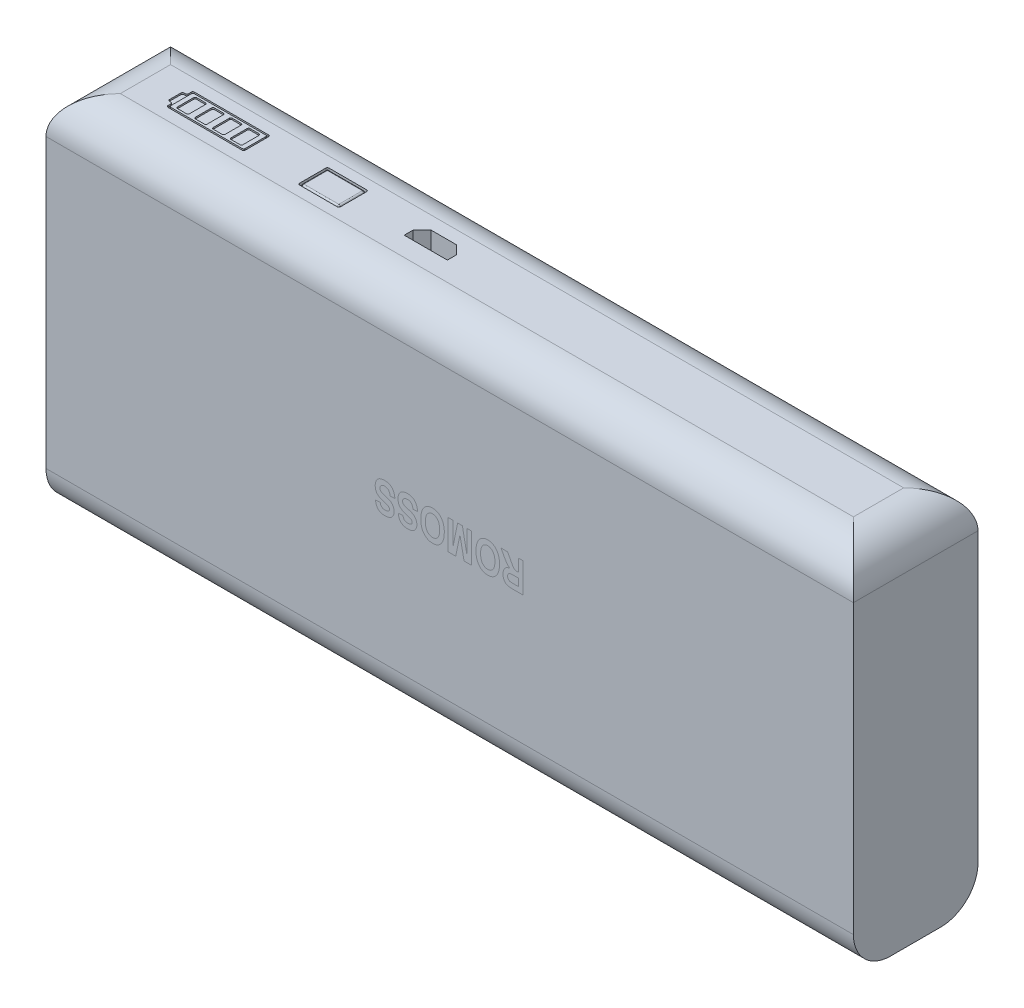
from build123d import *
from OCP.BRepFilletAPI import BRepFilletAPI_MakeChamfer

# Parameters (mm, degrees)
SKETCH1_W               = 137.9728
SKETCH1_H               = 21.2852
BOSS_EXTRUDE1_DEPTH     = 61.8236
FILLET10_R              = 6.35
FILLET11_R              = 6.35
SKETCH5_W               = 12.7
SKETCH5_H               = 4.0132
CUT_EXTRUDE1_DEPTH      = 0.254
FILLET12_R              = 0.254
SKETCH6_W               = 2.032
SKETCH6_H               = 3.2512
CUT_EXTRUDE2_DEPTH      = 0.254
FILLET13_R              = 0.254
LPATTERN1_COUNT         = 4
LPATTERN1_PITCH         = 3.048
FILLET13_OF_LPATTERN1_R = 0.254
SKETCH7_W               = 6.985
SKETCH7_H               = 5.0292
CUT_EXTRUDE3_DEPTH      = 0.508
SKETCH8_W               = 6.477
SKETCH8_H               = 4.5212
BOSS_EXTRUDE2_DEPTH     = 0.508
FILLET15_R              = 0.254
FILLET16_R              = 0.254
CUT_EXTRUDE4_DEPTH      = 6.35
SKETCH10_W              = 5.08
SKETCH10_H              = 12.7
CUT_EXTRUDE5_DEPTH      = 15.24
SKETCH11_W              = 1.27
SKETCH11_H              = 11.43
BOSS_EXTRUDE3_DEPTH     = 11.43
CHAMFER2_SIZE           = 0.508
CHAMFER2_SIZE2          = 0.293293937
SKETCH12_R              = 1.27
CUT_EXTRUDE6_DEPTH      = 0.254


with BuildPart() as part:
    # Sketch1 → Boss-Extrude1 (new body)
    with BuildSketch(Plane(origin=(0, 0, 0), x_dir=(1, 0, 0), z_dir=(0, 1, 0))):
        Rectangle(SKETCH1_W, SKETCH1_H)
    extrude(amount=BOSS_EXTRUDE1_DEPTH)

    # Fillet10
    fillet10_edges = [part.edges().sort_by_distance(p)[0] for p in [
        (-68.9864, 61.8236, 0),
        (0, 61.8236, 10.6426),
        (0, 61.8236, -10.6426),
        (68.9864, 61.8236, 0),
    ]]
    fillet(fillet10_edges, radius=FILLET10_R)

    # Fillet11
    fillet11_edges = [part.edges().sort_by_distance(p)[0] for p in [
        (0, 0, 10.6426),
        (0, 0, -10.6426),
    ]]
    fillet(fillet11_edges, radius=FILLET11_R)

    # Sketch5 → Cut-Extrude1 (cut)
    with BuildSketch(Plane(origin=(0, 61.8236, 0), x_dir=(1, 0, 0), z_dir=(0, 1, 0))):
        Polygon((-56.7944, 2.2606), (-56.7944, 1.2446), (-57.5564, 1.2446), (-57.5564, -1.2446), (-56.7944, -1.2446), (-56.7944, -2.2606), (-43.5864, -2.2606), (-43.5864, 2.2606), align=None)
        with Locations((-50.1904, 0)):
            Rectangle(SKETCH5_W, SKETCH5_H, mode=Mode.SUBTRACT)
    extrude(amount=-CUT_EXTRUDE1_DEPTH, mode=Mode.SUBTRACT)

    # Fillet12
    fillet12_edges = [part.edges().sort_by_distance(p)[0] for p in [
        (-43.5864, 61.6966, -2.2606),
        (-43.5864, 61.6966, 2.2606),
        (-43.8404, 61.6966, -2.0066),
        (-43.8404, 61.6966, 2.0066),
        (-56.5404, 61.6966, -2.0066),
        (-56.5404, 61.6966, 2.0066),
        (-56.7944, 61.6966, 2.2606),
        (-56.7944, 61.6966, 1.2446),
        (-56.7944, 61.6966, -1.2446),
        (-56.7944, 61.6966, -2.2606),
        (-57.5564, 61.6966, -1.2446),
        (-57.5564, 61.6966, 1.2446),
    ]]
    fillet(fillet12_edges, radius=FILLET12_R)

    # Sketch6 → Cut-Extrude2 (cut)
    with BuildSketch(Plane(origin=(0, 61.8236, 0), x_dir=(1, 0, 0), z_dir=(0, 1, 0))):
        with Locations((-54.7624, 0)):
            Rectangle(SKETCH6_W, SKETCH6_H)
    cut_extrude2 = extrude(amount=-CUT_EXTRUDE2_DEPTH, mode=Mode.SUBTRACT)

    # Fillet13
    fillet13_edges = [part.edges().sort_by_distance(p)[0] for p in [
        (-53.7464, 61.6966, 1.6256),
        (-55.7784, 61.6966, 1.6256),
        (-53.7464, 61.6966, -1.6256),
        (-55.7784, 61.6966, -1.6256),
    ]]
    fillet(fillet13_edges, radius=FILLET13_R)

    # LPattern1: Cut-Extrude2 ×4
    with Locations(*[(i * LPATTERN1_PITCH, 0, 0) for i in range(1, LPATTERN1_COUNT)]):
        add(cut_extrude2, mode=Mode.SUBTRACT)

    # Fillet13 of LPattern1
    fillet13_of_lpattern1_edges = [part.edges().sort_by_distance(p)[0] for p in [
        (-50.6984, 61.6966, 1.6256),
        (-52.7304, 61.6966, 1.6256),
        (-50.6984, 61.6966, -1.6256),
        (-52.7304, 61.6966, -1.6256),
        (-47.6504, 61.6966, 1.6256),
        (-49.6824, 61.6966, 1.6256),
        (-47.6504, 61.6966, -1.6256),
        (-49.6824, 61.6966, -1.6256),
        (-44.6024, 61.6966, 1.6256),
        (-46.6344, 61.6966, 1.6256),
        (-44.6024, 61.6966, -1.6256),
        (-46.6344, 61.6966, -1.6256),
    ]]
    fillet(fillet13_of_lpattern1_edges, radius=FILLET13_OF_LPATTERN1_R)

    # Sketch7 → Cut-Extrude3 (cut)
    with BuildSketch(Plane(origin=(0, 61.8236, 0), x_dir=(1, 0, 0), z_dir=(0, 1, 0))):
        with Locations((-30.5689, 0)):
            Rectangle(SKETCH7_W, SKETCH7_H)
    extrude(amount=-CUT_EXTRUDE3_DEPTH, mode=Mode.SUBTRACT)

    # Sketch8 → Boss-Extrude2 (add)
    with BuildSketch(Plane(origin=(0, 61.3156, 0), x_dir=(1, 0, 0), z_dir=(0, 1, 0))):
        with Locations((-30.5689, 0)):
            Rectangle(SKETCH8_W, SKETCH8_H)
    extrude(amount=BOSS_EXTRUDE2_DEPTH)

    # Fillet15
    fillet15_edges = [part.edges().sort_by_distance(p)[0] for p in [
        (-27.0764, 61.5696, 2.5146),
        (-27.0764, 61.5696, -2.5146),
        (-34.0614, 61.5696, -2.5146),
        (-34.0614, 61.5696, 2.5146),
    ]]
    fillet(fillet15_edges, radius=FILLET15_R)

    # Fillet16
    fillet16_edges = [part.edges().sort_by_distance(p)[0] for p in [
        (-30.5689, 61.8236, -2.2606),
        (-27.3304, 61.8236, 0),
        (-30.5689, 61.8236, 2.2606),
        (-33.8074, 61.8236, 0),
        (-33.8074, 61.5696, -2.2606),
        (-27.3304, 61.5696, -2.2606),
        (-27.3304, 61.5696, 2.2606),
        (-33.8074, 61.5696, 2.2606),
    ]]
    fillet(fillet16_edges, radius=FILLET16_R)

    # Sketch9 → Cut-Extrude4 (cut)
    with BuildSketch(Plane(origin=(0, 61.8236, 0), x_dir=(1, 0, 0), z_dir=(0, 1, 0))):
        Polygon((-17.4244, -0.9906), (-10.0584, -0.9906), (-10.0584, 0.5334), (-11.5824, 2.0574), (-15.9004, 2.0574), (-17.4244, 0.5334), align=None)
    extrude(amount=-CUT_EXTRUDE4_DEPTH, mode=Mode.SUBTRACT)

    # Sketch10 → Cut-Extrude5 (cut)
    with BuildSketch(Plane.ZY.offset(68.9864)):
        with Locations((-5.0546, 49.1236)):
            Rectangle(SKETCH10_W, SKETCH10_H)
        with Locations((3.5306, 49.1236)):
            Rectangle(SKETCH10_W, SKETCH10_H)
    extrude(amount=-CUT_EXTRUDE5_DEPTH, mode=Mode.SUBTRACT)

    # Sketch11 → Boss-Extrude3 (add)
    with BuildSketch(Plane.ZY.offset(53.7464)):
        with Locations((-5.4356, 49.1236)):
            Rectangle(SKETCH11_W, SKETCH11_H)
        with Locations((3.1496, 49.1236)):
            Rectangle(SKETCH11_W, SKETCH11_H)
    extrude(amount=BOSS_EXTRUDE3_DEPTH)

    # Chamfer2: one chamfer whose edges measure the first distance from different faces: ONE call of the kernel's chamfer builder (chamfer() names one face for all edges)
    chamfer2_edges_1 = [part.edges().sort_by_distance(p)[0] for p in [
        (-65.1764, 43.4086, -5.4356),
    ]]
    chamfer2_side_1 = [part.faces().sort_by_distance(p)[0] for p in [
        (-59.4614, 43.4086, -5.4356),
    ]]
    chamfer2_edges_2 = [part.edges().sort_by_distance(p)[0] for p in [
        (-65.1764, 49.1236, -6.0706),
    ]]
    chamfer2_side_2 = [part.faces().sort_by_distance(p)[0] for p in [
        (-59.4614, 49.1236, -6.0706),
    ]]
    chamfer2_edges_3 = [part.edges().sort_by_distance(p)[0] for p in [
        (-65.1764, 54.8386, -5.4356),
    ]]
    chamfer2_side_3 = [part.faces().sort_by_distance(p)[0] for p in [
        (-59.4614, 54.8386, -5.4356),
    ]]
    chamfer2_edges_4 = [part.edges().sort_by_distance(p)[0] for p in [
        (-65.1764, 49.1236, -4.8006),
    ]]
    chamfer2_side_4 = [part.faces().sort_by_distance(p)[0] for p in [
        (-59.4614, 49.1236, -4.8006),
    ]]
    chamfer2_edges_5 = [part.edges().sort_by_distance(p)[0] for p in [
        (-65.1764, 43.4086, 3.1496),
    ]]
    chamfer2_side_5 = [part.faces().sort_by_distance(p)[0] for p in [
        (-59.4614, 43.4086, 3.1496),
    ]]
    chamfer2_edges_6 = [part.edges().sort_by_distance(p)[0] for p in [
        (-65.1764, 49.1236, 2.5146),
    ]]
    chamfer2_side_6 = [part.faces().sort_by_distance(p)[0] for p in [
        (-59.4614, 49.1236, 2.5146),
    ]]
    chamfer2_edges_7 = [part.edges().sort_by_distance(p)[0] for p in [
        (-65.1764, 54.8386, 3.1496),
    ]]
    chamfer2_side_7 = [part.faces().sort_by_distance(p)[0] for p in [
        (-59.4614, 54.8386, 3.1496),
    ]]
    chamfer2_edges_8 = [part.edges().sort_by_distance(p)[0] for p in [
        (-65.1764, 49.1236, 3.7846),
    ]]
    chamfer2_side_8 = [part.faces().sort_by_distance(p)[0] for p in [
        (-59.4614, 49.1236, 3.7846),
    ]]
    chamfer2 = BRepFilletAPI_MakeChamfer(part.part.solid().wrapped)
    for e in chamfer2_edges_1:
        chamfer2.Add(CHAMFER2_SIZE, CHAMFER2_SIZE2, e.wrapped, chamfer2_side_1[0].wrapped)  # the first distance lies on this face
    for e in chamfer2_edges_2:
        chamfer2.Add(CHAMFER2_SIZE, CHAMFER2_SIZE2, e.wrapped, chamfer2_side_2[0].wrapped)  # the first distance lies on this face
    for e in chamfer2_edges_3:
        chamfer2.Add(CHAMFER2_SIZE, CHAMFER2_SIZE2, e.wrapped, chamfer2_side_3[0].wrapped)  # the first distance lies on this face
    for e in chamfer2_edges_4:
        chamfer2.Add(CHAMFER2_SIZE, CHAMFER2_SIZE2, e.wrapped, chamfer2_side_4[0].wrapped)  # the first distance lies on this face
    for e in chamfer2_edges_5:
        chamfer2.Add(CHAMFER2_SIZE, CHAMFER2_SIZE2, e.wrapped, chamfer2_side_5[0].wrapped)  # the first distance lies on this face
    for e in chamfer2_edges_6:
        chamfer2.Add(CHAMFER2_SIZE, CHAMFER2_SIZE2, e.wrapped, chamfer2_side_6[0].wrapped)  # the first distance lies on this face
    for e in chamfer2_edges_7:
        chamfer2.Add(CHAMFER2_SIZE, CHAMFER2_SIZE2, e.wrapped, chamfer2_side_7[0].wrapped)  # the first distance lies on this face
    for e in chamfer2_edges_8:
        chamfer2.Add(CHAMFER2_SIZE, CHAMFER2_SIZE2, e.wrapped, chamfer2_side_8[0].wrapped)  # the first distance lies on this face
    add(Compound.cast(chamfer2.Shape()), mode=Mode.REPLACE)

    # Sketch12 → Cut-Extrude6 (cut)
    with BuildSketch(Plane.ZY.offset(68.9864)):
        with Locations((-5.0546, 38.7096)):
            Circle(SKETCH12_R)
        with BuildLine():
            Line((4.8006, 39.4716), (4.8006, 37.9476))
            ThreePointArc((4.8006, 37.9476), (3.5306, 36.6776), (2.2606, 37.9476))
            Line((2.2606, 37.9476), (2.2606, 39.4716))
            ThreePointArc((2.2606, 39.4716), (3.5306, 40.7416), (4.8006, 39.4716))
        make_face()
    extrude(amount=-CUT_EXTRUDE6_DEPTH, mode=Mode.SUBTRACT)


solid = part.part
